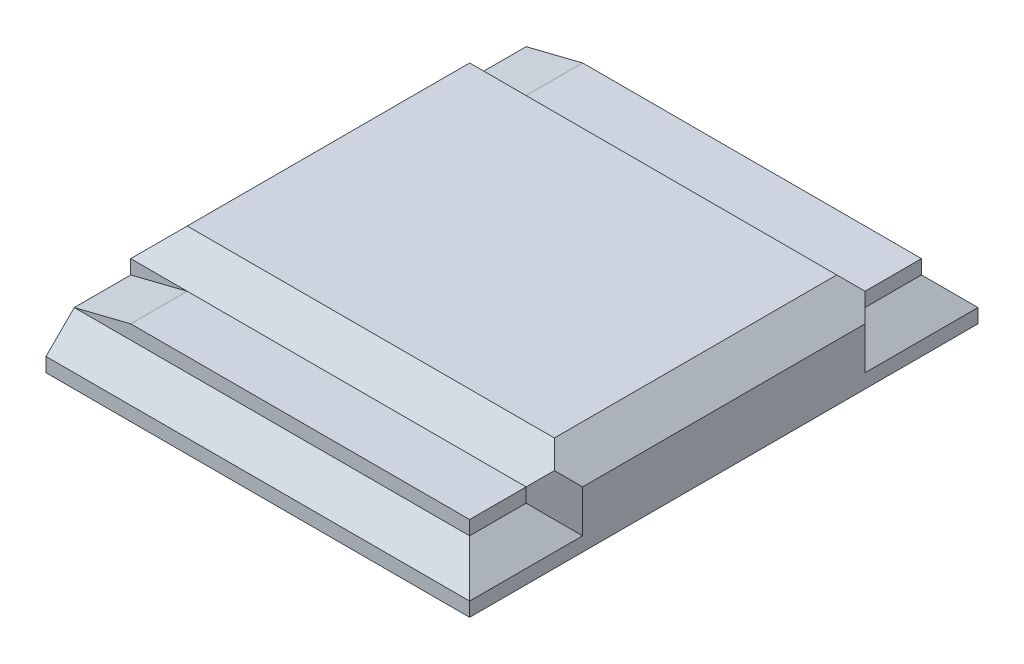
from build123d import *

# Parameters (mm, degrees)
SKETCH_1_W          = 18
SKETCH_1_H          = 18
EXTRUDE_1_DEPTH     = 1.5
CHAMFER_1_SIZE      = 1
SKETCH_2_W          = 18
SKETCH_2_H          = 12
EXTRUDE_2_DEPTH     = 1.5
CHAMFER_2_SIZE      = 1
CHAMFER_3_SIZE      = 1
CUT_EXTRUDE_2_DEPTH = 3
CHAMFER_5_SIZE      = 1
CUT_EXTRUDE_5_DEPTH = 3
EXTRUDE_12_DEPTH    = 2
EXTRUDE_13_DEPTH    = 2


with BuildPart() as part:
    # 草图1 → 凸台-拉伸1 (new body)
    with BuildSketch(Plane(origin=(0, 0, 0), x_dir=(1, 0, 0), z_dir=(0, 1, 0))):
        Rectangle(SKETCH_1_W, SKETCH_1_H)
    extrude(amount=EXTRUDE_1_DEPTH)

    # 倒角1
    chamfer_1_edges = [part.edges().sort_by_distance(p)[0] for p in [
        (0, 1.5, 9),
        (0, 1.5, -9),
    ]]
    chamfer(chamfer_1_edges, length=CHAMFER_1_SIZE)

    # 草图2 → 凸台-拉伸2 (add)
    with BuildSketch(Plane(origin=(0, 1.5, 0), x_dir=(1, 0, 0), z_dir=(0, 1, 0))):
        Rectangle(SKETCH_2_W, SKETCH_2_H)
    extrude(amount=EXTRUDE_2_DEPTH)

    # 倒角2
    chamfer_2_edges = [part.edges().sort_by_distance(p)[0] for p in [
        (0, 3, 6),
        (0, 3, -6),
    ]]
    chamfer(chamfer_2_edges, length=CHAMFER_2_SIZE)

    # 倒角3
    # the kernel refuses this chamfer: 1 mm, written as the material it takes off along each edge
    with BuildSketch(Plane(origin=(9, 1.5, 6), x_dir=(-0.9996219169112968, 0, 0.027495876610586487), z_dir=(0, 1, 0))) as chamfer_3_piece_1:
        Polygon((CHAMFER_3_SIZE * 0.999621916911, -CHAMFER_3_SIZE * 0.0274958766106), (-CHAMFER_3_SIZE * 0.0274958766106, -CHAMFER_3_SIZE * 0.999621916911), (0, 0), align=None)
    extrude(amount=3.071682988, mode=Mode.SUBTRACT)
    with BuildSketch(Plane(origin=(9, 1.5, 10.571682988), x_dir=(-0.9996219169112968, 0.02749587661058627, 0), z_dir=(0, 0, -1)), Plane(origin=(9, 1.5, -6), x_dir=(-0.9996219169112968, 0.02749587661058627, 0), z_dir=(0, 0, -1))) as chamfer_3_piece_2:
        Polygon((CHAMFER_3_SIZE * 0.999621916911, -CHAMFER_3_SIZE * 0.0274958766106), (-CHAMFER_3_SIZE * 0.0274958766106, -CHAMFER_3_SIZE * 0.999621916911), (0, 0), align=None)
    extrude(amount=4.571682988, mode=Mode.SUBTRACT)
    with BuildSketch(Plane(origin=(9, 1.5, -6), x_dir=(-0.9996219169112968, 0, -0.027495876610586535), z_dir=(0, 1, 0))) as chamfer_3_piece_3:
        Polygon((CHAMFER_3_SIZE * 0.999621916911, CHAMFER_3_SIZE * 0.0274958766106), (-CHAMFER_3_SIZE * 0.0274958766106, CHAMFER_3_SIZE * 0.999621916911), (0, 0), align=None)
    extrude(amount=3.071682988, mode=Mode.SUBTRACT)
    with BuildSketch(Plane(origin=(9, 3, -7.571682988), x_dir=(-0.9996219169112968, 0.027495876610586487, 0), z_dir=(0, 0, 1))) as chamfer_3_piece_4:
        Polygon((CHAMFER_3_SIZE * 0.999621916911, CHAMFER_3_SIZE * 0.0274958766106), (-CHAMFER_3_SIZE * 0.0274958766106, CHAMFER_3_SIZE * 0.999621916911), (0, 0), align=None)
    extrude(amount=15.143365976, mode=Mode.SUBTRACT)
    with BuildSketch(Plane(origin=(9, -1.071682988, 6), x_dir=(-0.9996219169112968, 0, 0.027495876610586487), z_dir=(0, 1, 0))) as chamfer_3_piece_5a_section:
        Polygon((CHAMFER_3_SIZE * 0.999621916911, -CHAMFER_3_SIZE * 0.0274958766106), (-CHAMFER_3_SIZE * 0.0274958766106, -CHAMFER_3_SIZE * 0.999621916911), (0, 0), align=None)
    chamfer_3_piece_5a = extrude(amount=5.643365976, mode=Mode.PRIVATE)
    chamfer_3_piece_5a = split(chamfer_3_piece_5a, bisect_by=Plane(origin=(8.670206373, 1.5, 5.670206373), z_dir=(0, -1, 0)), keep=Keep.TOP, mode=Mode.PRIVATE)
    with BuildSketch(Plane(origin=(9, 1.5, 10.571682988), x_dir=(-0.9996219169112968, 0.02749587661058627, 0), z_dir=(0, 0, -1))) as chamfer_3_piece_5b_section:
        Polygon((CHAMFER_3_SIZE * 0.999621916911, -CHAMFER_3_SIZE * 0.0274958766106), (-CHAMFER_3_SIZE * 0.0274958766106, -CHAMFER_3_SIZE * 0.999621916911), (0, 0), align=None)
    chamfer_3_piece_5b = extrude(amount=7.143365976, mode=Mode.PRIVATE)
    chamfer_3_piece_5b = split(chamfer_3_piece_5b, bisect_by=Plane(origin=(8.670206373, 1.170206373, 6), z_dir=(0, 0, -1)), keep=Keep.TOP, mode=Mode.PRIVATE)
    chamfer_3_piece_5 = chamfer_3_piece_5a & chamfer_3_piece_5b
    add(chamfer_3_piece_5, mode=Mode.SUBTRACT)
    with BuildSketch(Plane(origin=(9, -1.071682988, -6), x_dir=(-0.9996219169112968, 0, -0.027495876610586487), z_dir=(0, 1, 0))) as chamfer_3_piece_6a_section:
        Polygon((CHAMFER_3_SIZE * 0.999621916911, CHAMFER_3_SIZE * 0.0274958766106), (-CHAMFER_3_SIZE * 0.0274958766106, CHAMFER_3_SIZE * 0.999621916911), (0, 0), align=None)
    chamfer_3_piece_6a = extrude(amount=5.643365976, mode=Mode.PRIVATE)
    chamfer_3_piece_6a = split(chamfer_3_piece_6a, bisect_by=Plane(origin=(8.670206373, 1.5, -5.670206373), z_dir=(0, -1, 0)), keep=Keep.TOP, mode=Mode.PRIVATE)
    with BuildSketch(Plane(origin=(9, 1.5, -3.428317012), x_dir=(-0.9996219169112968, 0.02749587661058627, 0), z_dir=(0, 0, -1))) as chamfer_3_piece_6b_section:
        Polygon((CHAMFER_3_SIZE * 0.999621916911, -CHAMFER_3_SIZE * 0.0274958766106), (-CHAMFER_3_SIZE * 0.0274958766106, -CHAMFER_3_SIZE * 0.999621916911), (0, 0), align=None)
    chamfer_3_piece_6b = extrude(amount=7.143365976, mode=Mode.PRIVATE)
    chamfer_3_piece_6b = split(chamfer_3_piece_6b, bisect_by=Plane(origin=(8.670206373, 1.170206373, -6), z_dir=(0, 0, 1)), keep=Keep.TOP, mode=Mode.PRIVATE)
    chamfer_3_piece_6 = chamfer_3_piece_6a & chamfer_3_piece_6b
    add(chamfer_3_piece_6, mode=Mode.SUBTRACT)

    # 草图9 → 切除-拉伸2 (cut)
    with BuildSketch(Plane.ZY.offset(9)):
        Polygon((-6, 1.5), (-6, 2), (-5, 3), (5, 3), (6, 2), (6, 1.5), align=None)
    extrude(amount=-CUT_EXTRUDE_2_DEPTH, mode=Mode.SUBTRACT)

    # 倒角5
    chamfer_5_edges = [part.edges().sort_by_distance(p)[0] for p in [
        (-6, 3, 0),
    ]]
    chamfer(chamfer_5_edges, length=CHAMFER_5_SIZE)

    # 草图23 → 切除-拉伸5 (cut)
    with BuildSketch(Plane.ZY.offset(9)):
        Polygon((9, 0.5), (8, 1.5), (-8, 1.5), (-9, 0.5), (-9, 0), (9, 0), align=None)
    extrude(amount=-CUT_EXTRUDE_5_DEPTH, mode=Mode.SUBTRACT)

    # 草图24 → 凸台-拉伸12 (add)
    with BuildSketch(Plane(origin=(0, 0, -6), x_dir=(-1, 0, 0), z_dir=(0, 0, -1))):
        Polygon((6, 1.5), (4, 2), (-8, 2), (-8, 1.5), align=None)
    extrude(amount=EXTRUDE_12_DEPTH)

    # 草图25 → 凸台-拉伸13 (add)
    with BuildSketch(Plane.XY.offset(6)):
        Polygon((-6, 1.5), (-4, 2), (8, 2), (8, 1.5), align=None)
    extrude(amount=EXTRUDE_13_DEPTH)


solid = part.part
